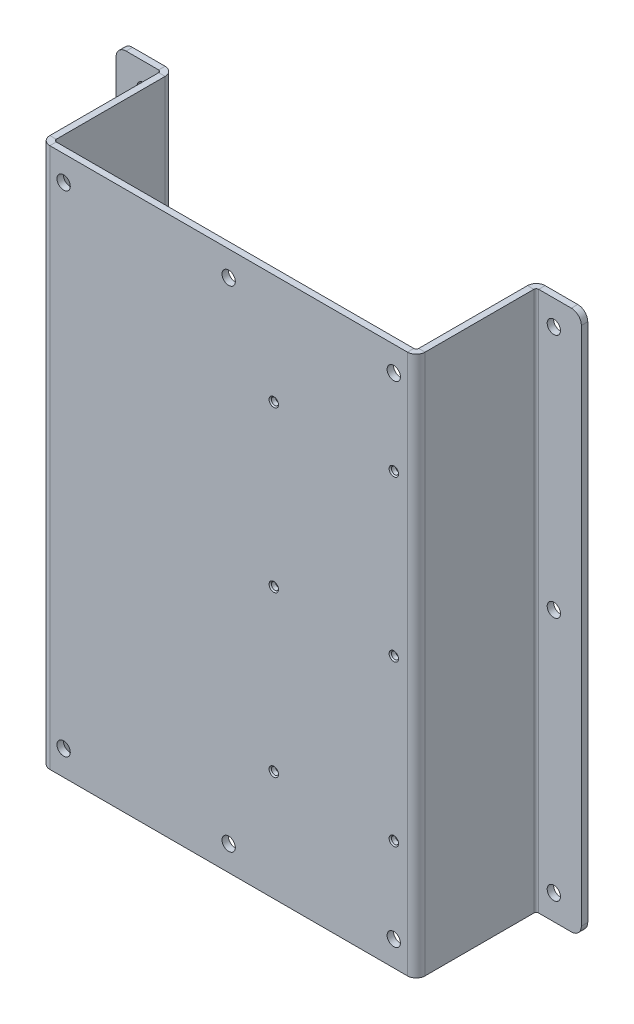
from build123d import *

# Parameters (mm, degrees)
BASE_FLANGE1_DEPTH             = 85.725
CUT_EXTRUDE1_REACH             = 122.047
SKETCH3_R                      = 2.1082
CUT_EXTRUDE2_REACH             = 122.047
SKETCH4_R                      = 2.1082
F_4_40_TAPPED_HOLE1_AT_2_COUNT = 2
F_4_40_TAPPED_HOLE1_AT_2_PITCH = 101.6
F_4_40_TAPPED_HOLE1_AT_3_COUNT = 2
F_4_40_TAPPED_HOLE1_AT_3_PITCH = 38.1
F_4_40_TAPPED_HOLE1_AT_4_COUNT = 2
F_4_40_TAPPED_HOLE1_AT_4_PITCH = 63.5
F_4_40_TAPPED_HOLE1_AT_5_COUNT = 2
F_4_40_TAPPED_HOLE1_AT_5_PITCH = 108.508847566
F_4_40_TAPPED_HOLE1_AT_6_COUNT = 2
F_4_40_TAPPED_HOLE1_AT_6_PITCH = 50.8
FILLET1_R                      = 3.175


# Sheet-metal steps are written as plain solids
with BuildPart() as part:
    # Sketch1 → Base-Flange1 (new, symmetric)
    with BuildSketch(Plane(origin=(0, 0, 0), x_dir=(1, 0, 0), z_dir=(0, 1, 0))):
        with BuildLine():
            Line((73.8378, -2.032), (60.2996, -2.032))
            ThreePointArc((60.2996, -2.032), (59.760784633, -2.255184633), (59.5376, -2.794))
            Line((59.5376, -2.794), (59.5376, -37.338))
            ThreePointArc((59.5376, -37.338), (58.719256347, -39.313656347), (56.7436, -40.132))
            Line((56.7436, -40.132), (-56.7436, -40.132))
            ThreePointArc((-56.7436, -40.132), (-58.719256347, -39.313656347), (-59.5376, -37.338))
            Line((-59.5376, -37.338), (-59.5376, -2.794))
            ThreePointArc((-59.5376, -2.794), (-59.760784633, -2.255184633), (-60.2996, -2.032))
            Line((-60.2996, -2.032), (-73.8378, -2.032))
            Line((-73.8378, -2.032), (-73.8378, 0))
            Line((-73.8378, 0), (-60.2996, 0))
            ThreePointArc((-60.2996, 0), (-58.323943653, -0.818343653), (-57.5056, -2.794))
            Line((-57.5056, -2.794), (-57.5056, -37.338))
            ThreePointArc((-57.5056, -37.338), (-57.282415367, -37.876815367), (-56.7436, -38.1))
            Line((-56.7436, -38.1), (56.7436, -38.1))
            ThreePointArc((56.7436, -38.1), (57.282415367, -37.876815367), (57.5056, -37.338))
            Line((57.5056, -37.338), (57.5056, -2.794))
            ThreePointArc((57.5056, -2.794), (58.323943653, -0.818343653), (60.2996, 0))
            Line((60.2996, 0), (73.8378, 0))
            Line((73.8378, 0), (73.8378, -2.032))
        make_face()
    extrude(amount=BASE_FLANGE1_DEPTH, both=True)

    # Sketch3 → Cut-Extrude1 (cut, up to next)
    with BuildSketch(Plane.XY.offset(40.132), mode=Mode.PRIVATE) as cut_extrude1_sk1:
        with Locations((52.4002, 77.8002)):
            Circle(SKETCH3_R)
    cut_extrude1_tool1 = extrude(cut_extrude1_sk1.sketch, amount=-CUT_EXTRUDE1_REACH, mode=Mode.PRIVATE) & part.part
    # Sketch3 → Cut-Extrude1 (cut, up to next)
    with BuildSketch(Plane.XY.offset(40.132), mode=Mode.PRIVATE) as cut_extrude1_sk2:
        with Locations((52.4002, -77.7748)):
            Circle(SKETCH3_R)
    cut_extrude1_tool2 = extrude(cut_extrude1_sk2.sketch, amount=-CUT_EXTRUDE1_REACH, mode=Mode.PRIVATE) & part.part
    # Sketch3 → Cut-Extrude1 (cut, up to next)
    with BuildSketch(Plane.XY.offset(40.132), mode=Mode.PRIVATE) as cut_extrude1_sk3:
        with Locations((-52.3748, 77.8002)):
            Circle(SKETCH3_R)
    cut_extrude1_tool3 = extrude(cut_extrude1_sk3.sketch, amount=-CUT_EXTRUDE1_REACH, mode=Mode.PRIVATE) & part.part
    # Sketch3 → Cut-Extrude1 (cut, up to next)
    with BuildSketch(Plane.XY.offset(40.132), mode=Mode.PRIVATE) as cut_extrude1_sk4:
        with Locations((-52.3748, -77.7748)):
            Circle(SKETCH3_R)
    cut_extrude1_tool4 = extrude(cut_extrude1_sk4.sketch, amount=-CUT_EXTRUDE1_REACH, mode=Mode.PRIVATE) & part.part
    # Sketch3 → Cut-Extrude1 (cut, up to next)
    with BuildSketch(Plane.XY.offset(40.132), mode=Mode.PRIVATE) as cut_extrude1_sk5:
        with Locations((0, 77.8002)):
            Circle(SKETCH3_R)
    cut_extrude1_tool5 = extrude(cut_extrude1_sk5.sketch, amount=-CUT_EXTRUDE1_REACH, mode=Mode.PRIVATE) & part.part
    # Sketch3 → Cut-Extrude1 (cut, up to next)
    with BuildSketch(Plane.XY.offset(40.132), mode=Mode.PRIVATE) as cut_extrude1_sk6:
        with Locations((0, -77.7748)):
            Circle(SKETCH3_R)
    cut_extrude1_tool6 = extrude(cut_extrude1_sk6.sketch, amount=-CUT_EXTRUDE1_REACH, mode=Mode.PRIVATE) & part.part
    add(cut_extrude1_tool1.solids().sort_by_distance((52.4002, 77.8002, 40.132))[0], mode=Mode.SUBTRACT)
    add(cut_extrude1_tool2.solids().sort_by_distance((52.4002, -77.7748, 40.132))[0], mode=Mode.SUBTRACT)
    add(cut_extrude1_tool3.solids().sort_by_distance((-52.3748, 77.8002, 40.132))[0], mode=Mode.SUBTRACT)
    add(cut_extrude1_tool4.solids().sort_by_distance((-52.3748, -77.7748, 40.132))[0], mode=Mode.SUBTRACT)
    add(cut_extrude1_tool5.solids().sort_by_distance((0, 77.8002, 40.132))[0], mode=Mode.SUBTRACT)
    add(cut_extrude1_tool6.solids().sort_by_distance((0, -77.7748, 40.132))[0], mode=Mode.SUBTRACT)

    # Sketch4 → Cut-Extrude2 (cut, up to next)
    with BuildSketch(Plane.XY, mode=Mode.PRIVATE) as cut_extrude2_sk1:
        with Locations((65.1002, -77.7748)):
            Circle(SKETCH4_R)
    cut_extrude2_tool1 = extrude(cut_extrude2_sk1.sketch, amount=CUT_EXTRUDE2_REACH, mode=Mode.PRIVATE) & part.part
    # Sketch4 → Cut-Extrude2 (cut, up to next)
    with BuildSketch(Plane.XY, mode=Mode.PRIVATE) as cut_extrude2_sk2:
        with Locations((65.1002, 77.8002)):
            Circle(SKETCH4_R)
    cut_extrude2_tool2 = extrude(cut_extrude2_sk2.sketch, amount=CUT_EXTRUDE2_REACH, mode=Mode.PRIVATE) & part.part
    # Sketch4 → Cut-Extrude2 (cut, up to next)
    with BuildSketch(Plane.XY, mode=Mode.PRIVATE) as cut_extrude2_sk3:
        with Locations((-65.0748, 77.8002)):
            Circle(SKETCH4_R)
    cut_extrude2_tool3 = extrude(cut_extrude2_sk3.sketch, amount=CUT_EXTRUDE2_REACH, mode=Mode.PRIVATE) & part.part
    # Sketch4 → Cut-Extrude2 (cut, up to next)
    with BuildSketch(Plane.XY, mode=Mode.PRIVATE) as cut_extrude2_sk4:
        with Locations((-65.0748, -77.7748)):
            Circle(SKETCH4_R)
    cut_extrude2_tool4 = extrude(cut_extrude2_sk4.sketch, amount=CUT_EXTRUDE2_REACH, mode=Mode.PRIVATE) & part.part
    # Sketch4 → Cut-Extrude2 (cut, up to next)
    with BuildSketch(Plane.XY, mode=Mode.PRIVATE) as cut_extrude2_sk5:
        with Locations((65.1002, 0)):
            Circle(SKETCH4_R)
    cut_extrude2_tool5 = extrude(cut_extrude2_sk5.sketch, amount=CUT_EXTRUDE2_REACH, mode=Mode.PRIVATE) & part.part
    # Sketch4 → Cut-Extrude2 (cut, up to next)
    with BuildSketch(Plane.XY, mode=Mode.PRIVATE) as cut_extrude2_sk6:
        with Locations((-65.0748, 0)):
            Circle(SKETCH4_R)
    cut_extrude2_tool6 = extrude(cut_extrude2_sk6.sketch, amount=CUT_EXTRUDE2_REACH, mode=Mode.PRIVATE) & part.part
    add(cut_extrude2_tool1.solids().sort_by_distance((65.1002, -77.7748, 0))[0], mode=Mode.SUBTRACT)
    add(cut_extrude2_tool2.solids().sort_by_distance((65.1002, 77.8002, 0))[0], mode=Mode.SUBTRACT)
    add(cut_extrude2_tool3.solids().sort_by_distance((-65.0748, 77.8002, 0))[0], mode=Mode.SUBTRACT)
    add(cut_extrude2_tool4.solids().sort_by_distance((-65.0748, -77.7748, 0))[0], mode=Mode.SUBTRACT)
    add(cut_extrude2_tool5.solids().sort_by_distance((65.1002, 0, 0))[0], mode=Mode.SUBTRACT)
    add(cut_extrude2_tool6.solids().sort_by_distance((-65.0748, 0, 0))[0], mode=Mode.SUBTRACT)

    # Sketch5 → #4-40 Tapped Hole1 (revolve, cut)
    with BuildSketch(Plane(origin=(52.4256, -50.8, 40.132), x_dir=(0, -1, 0), z_dir=(1, 0, 0))):
        Polygon((0, 0), (0, 2.032), (1.4986, 2.032), (1.1303, 1.6637), (1.1303, 0.3683), (1.4986, 0), align=None)
    f_4_40_tapped_hole1 = revolve(axis=Axis((52.4256, -50.8, 46.482), (0, 0, -1)), mode=Mode.SUBTRACT)

    # #4-40 Tapped Hole1 at 2: #4-40 Tapped Hole1 ×2
    with Locations(*[(0, i * F_4_40_TAPPED_HOLE1_AT_2_PITCH, 0) for i in range(1, F_4_40_TAPPED_HOLE1_AT_2_COUNT)]):
        add(f_4_40_tapped_hole1, mode=Mode.SUBTRACT)

    # #4-40 Tapped Hole1 at 3: #4-40 Tapped Hole1 ×2
    with Locations(*[(-i * F_4_40_TAPPED_HOLE1_AT_3_PITCH, 0, 0) for i in range(1, F_4_40_TAPPED_HOLE1_AT_3_COUNT)]):
        add(f_4_40_tapped_hole1, mode=Mode.SUBTRACT)

    # #4-40 Tapped Hole1 at 4: #4-40 Tapped Hole1 ×2
    with Locations(*[Vector(-0.6000000000000001, 0.8, 0) * (i * F_4_40_TAPPED_HOLE1_AT_4_PITCH) for i in range(1, F_4_40_TAPPED_HOLE1_AT_4_COUNT)]):
        add(f_4_40_tapped_hole1, mode=Mode.SUBTRACT)

    # #4-40 Tapped Hole1 at 5: #4-40 Tapped Hole1 ×2
    with Locations(*[Vector(-0.35112344158839176, 0.9363291775690445, 0) * (i * F_4_40_TAPPED_HOLE1_AT_5_PITCH) for i in range(1, F_4_40_TAPPED_HOLE1_AT_5_COUNT)]):
        add(f_4_40_tapped_hole1, mode=Mode.SUBTRACT)

    # #4-40 Tapped Hole1 at 6: #4-40 Tapped Hole1 ×2
    with Locations(*[(0, i * F_4_40_TAPPED_HOLE1_AT_6_PITCH, 0) for i in range(1, F_4_40_TAPPED_HOLE1_AT_6_COUNT)]):
        add(f_4_40_tapped_hole1, mode=Mode.SUBTRACT)

    # Fillet1
    fillet1_edges = [part.edges().sort_by_distance(p)[0] for p in [
        (73.8378, -85.725, 1.016),
        (-73.8378, -85.725, 1.016),
        (73.8378, 85.725, 1.016),
        (-73.8378, 85.725, 1.016),
    ]]
    fillet(fillet1_edges, radius=FILLET1_R)


solid = part.part
